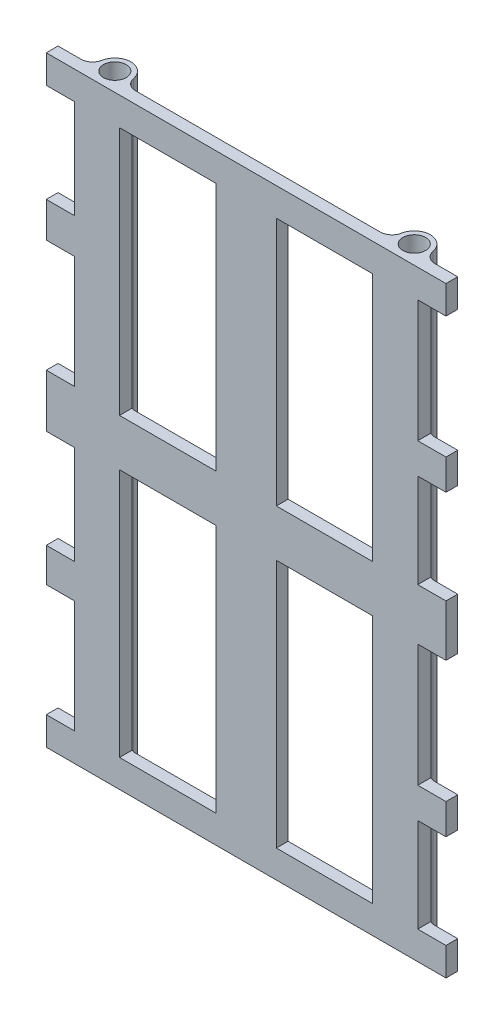
from build123d import *

# Parameters (mm, degrees)
SKETCH1_R               = 4.825
BOSS_EXTRUDE1_DEPTH     = 255.8
CUT_EXTRUDE2_DEPTH      = 270.725525349
CUT_EXTRUDE2_DEPTH_BACK = 270.725525349
SKETCH2_W               = 41
SKETCH2_H               = 106
SKETCH2_W_2             = 20
SKETCH2_H_2             = 40
SKETCH2_H_3             = 51.9
SKETCH2_H_4             = 52
SKETCH2_H_5             = 42
SKETCH2_H_6             = 47.9


with BuildPart() as part:
    # Sketch1 → Boss-Extrude1 (new body)
    with BuildSketch(Plane(origin=(0, 0, 0), x_dir=(1, 0, 0), z_dir=(0, 1, 0))):
        with BuildLine():
            Line((85, -5), (85, 0))
            Line((85, 0), (75.304187068, 0))
            ThreePointArc((75.304187068, 0), (72.10948347, 1.153720119), (70.389097399, 4.082452431))
            ThreePointArc((70.389097399, 4.082452431), (63.68, 9.655), (56.970902601, 4.082452431))
            ThreePointArc((56.970902601, 4.082452431), (55.25051653, 1.153720119), (52.055812932, 0))
            Line((52.055812932, 0), (-52.055812932, 0))
            ThreePointArc((-52.055812932, 0), (-55.25051653, 1.153720119), (-56.970902601, 4.082452431))
            ThreePointArc((-56.970902601, 4.082452431), (-63.68, 9.655), (-70.389097399, 4.082452431))
            ThreePointArc((-70.389097399, 4.082452431), (-72.10948347, 1.153720119), (-75.304187068, 0))
            Line((-75.304187068, 0), (-85, 0))
            Line((-85, 0), (-85, -5))
            Line((-85, -5), (85, -5))
        make_face()
        with Locations((-63.68, 2.83)):
            Circle(SKETCH1_R, mode=Mode.SUBTRACT)
        with Locations((63.68, 2.83)):
            Circle(SKETCH1_R, mode=Mode.SUBTRACT)
    extrude(amount=BOSS_EXTRUDE1_DEPTH)

    # Sketch2 → Cut-Extrude2 (cut, two sides: drawn at the far end of the back side and taken through both)
    with BuildSketch(Plane(origin=(0, 0, 0), x_dir=(-1, 0, 0), z_dir=(0, 0, -1)).offset(-CUT_EXTRUDE2_DEPTH_BACK)):
        with Locations((-33.355, 64.8)):
            Rectangle(SKETCH2_W, SKETCH2_H)
        with Locations((-33.355, 190.8)):
            Rectangle(SKETCH2_W, SKETCH2_H)
        with Locations((-83, 158.9)):
            Rectangle(SKETCH2_W_2, SKETCH2_H_2)
        with Locations((33.355, 64.8)):
            Rectangle(SKETCH2_W, SKETCH2_H)
        with Locations((33.355, 190.8)):
            Rectangle(SKETCH2_W, SKETCH2_H)
        with Locations((-83, 32)):
            Rectangle(SKETCH2_W_2, SKETCH2_H_2)
        with Locations((-83, 217.85)):
            Rectangle(SKETCH2_W_2, SKETCH2_H_3)
        with Locations((-83, 91)):
            Rectangle(SKETCH2_W_2, SKETCH2_H_4)
        with Locations((83, 222.8)):
            Rectangle(SKETCH2_W_2, SKETCH2_H_5)
        with Locations((83, 95.4)):
            Rectangle(SKETCH2_W_2, SKETCH2_H_5)
        with Locations((83, 162.85)):
            Rectangle(SKETCH2_W_2, SKETCH2_H_6)
        with Locations((83, 35.95)):
            Rectangle(SKETCH2_W_2, SKETCH2_H_6)
    extrude(amount=CUT_EXTRUDE2_DEPTH + CUT_EXTRUDE2_DEPTH_BACK, mode=Mode.SUBTRACT)


solid = part.part
